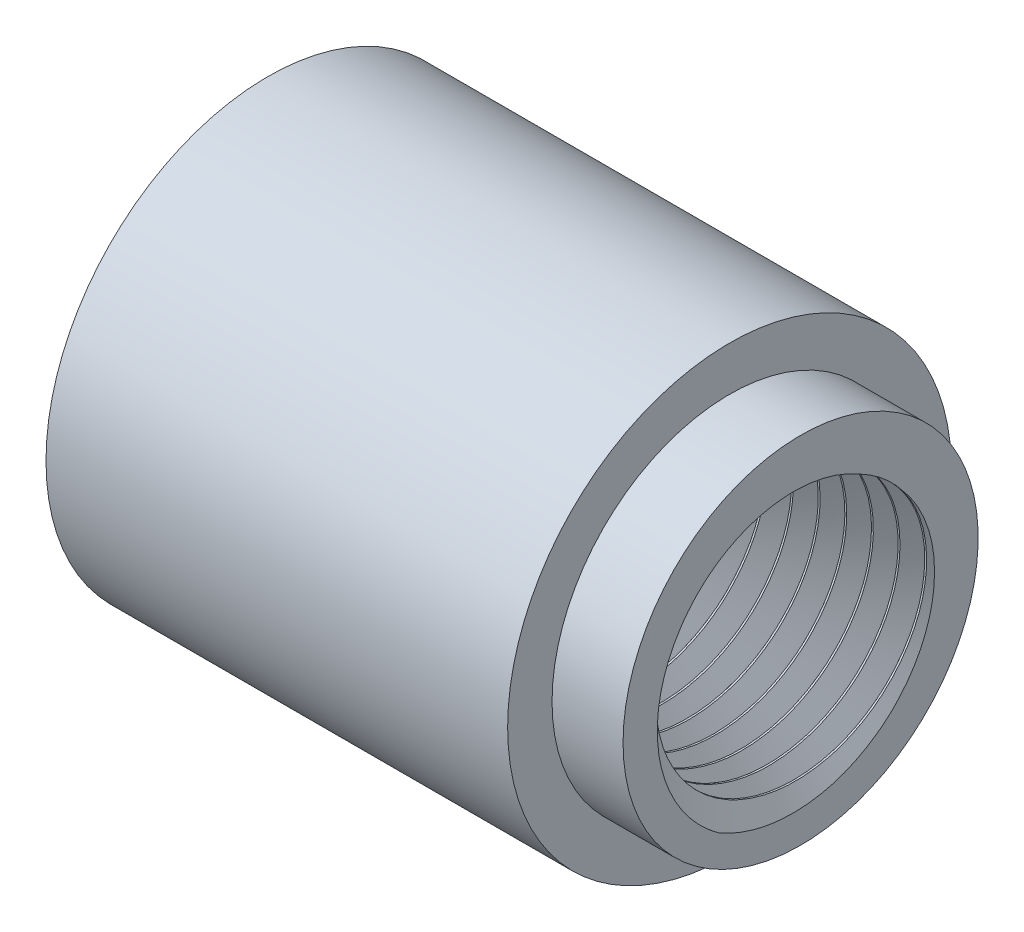
from build123d import *

# Parameters (mm, degrees)
CORTAR_BARRER2_PITCH = 1.5


with BuildPart() as part:
    # Croquis1 → Revolución1 (revolve)
    with BuildSketch(Plane.XY, mode=Mode.PRIVATE) as revoluci_n1_sk:
        Polygon((0, 7.25), (30, 7.25), (30, 10), (26, 10), (26, 12.5), (0, 12.5), align=None)
    revolve(revoluci_n1_sk.sketch.rotate(Axis((0, 0, 0), (1, 0, 0)), 90), axis=Axis((0, 0, 0), (1, 0, 0)))

    # Cortar-Barrer2: arcs per turn and ends read off the stored shape
    # Cortar-Barrer2: the profile of Croquis3 screwed along a right-hand helix through 26 turns, 8 arcs to a turn; built about Z, then put on its axis
    cortar_barrer2_z = Axis((0, 0, 0), (0, 0, 1))
    cortar_barrer2_corners = [(7.232407507, 0.047268207, -1.435475371), (7.232407507, 0.000730079, -0.022171569), (8.456495687, 0.023029136, -0.699365585)]
    with BuildLine(mode=Mode.PRIVATE) as cortar_barrer2_profile:
        Line(cortar_barrer2_corners[0], cortar_barrer2_corners[1])
        Line(cortar_barrer2_corners[1], cortar_barrer2_corners[2])
        Line(cortar_barrer2_corners[2], cortar_barrer2_corners[0])
    cortar_barrer2_cap = Face(cortar_barrer2_profile.wire())
    cortar_barrer2_turn_angles = [0, 22.5, 45, 67.5, 90, 112.5, 135, 157.5, 180, 202.5, 225, 247.5, 270, 292.5, 315, 337.5, 360]
    cortar_barrer2_turn_weights = [1, 0.9238795325112867, 1, 0.9238795325112867, 1, 0.9238795325112867, 1, 0.9238795325112867, 1, 0.9238795325112867, 1, 0.9238795325112867, 1, 0.9238795325112867, 1, 0.9238795325112867, 1]
    cortar_barrer2_turn_rails = [Edge.make_bspline([Vector(p[0], p[1], 0).rotate(cortar_barrer2_z, cortar_barrer2_turn_angles[k]) / cortar_barrer2_turn_weights[k] + Vector(0, 0, p[2] + CORTAR_BARRER2_PITCH * cortar_barrer2_turn_angles[k] / 360) for k in range(17)], [0, 0, 0, 1, 1, 2, 2, 3, 3, 4, 4, 5, 5, 6, 6, 7, 7, 8, 8, 8], 2, cortar_barrer2_turn_weights) for p in cortar_barrer2_corners]
    cortar_barrer2_turn_sides = [Face.make_surface_from_curves(cortar_barrer2_turn_rails[p[0]], cortar_barrer2_turn_rails[p[1]]) for p in [(0, 1), (1, 2), (2, 0)]]
    cortar_barrer2 = Plane(origin=(30, 0, 0), x_dir=(0, 0.7071067811865488, -0.7071067811865464), z_dir=(-1, 0, 0)) * Solid(Shell([*[p.moved(Location((0, 0, CORTAR_BARRER2_PITCH * i))) for i in range(26) for p in cortar_barrer2_turn_sides], cortar_barrer2_cap, cortar_barrer2_cap.rotate(cortar_barrer2_z, 9360).moved(Location((0, 0, CORTAR_BARRER2_PITCH * 9360 / 360)))]))
    add(cortar_barrer2, mode=Mode.SUBTRACT)


solid = part.part
